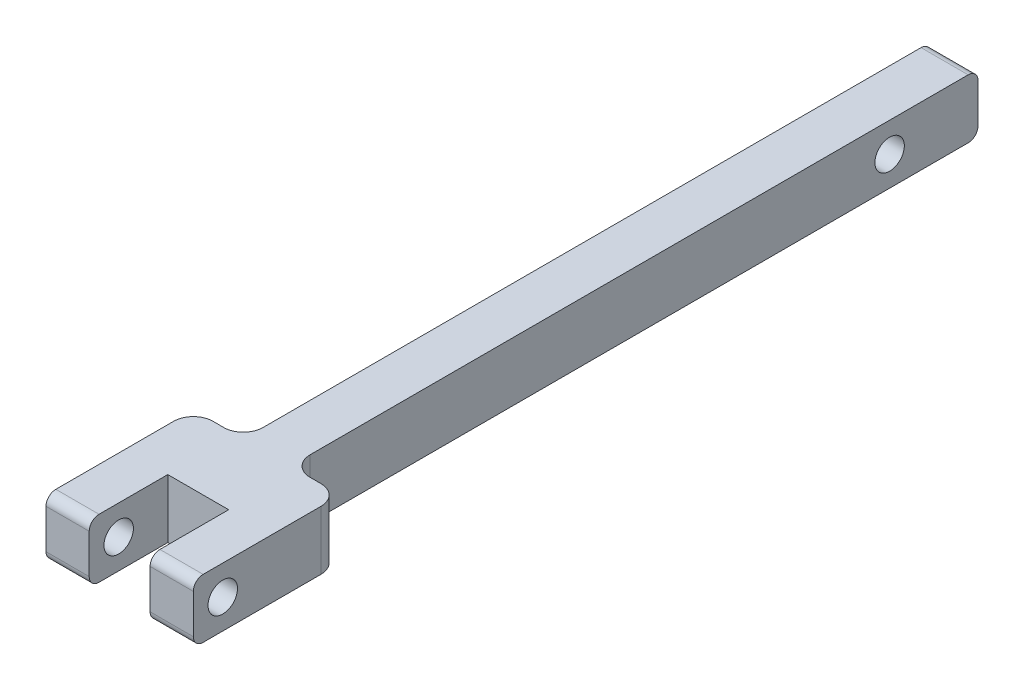
from build123d import *
from build123d.topology import SkipClean

# Parameters (mm, degrees)
SALIENTE_EXTRUIR1_DEPTH    = 2.4
CORTAR_EXTRUIR1_DEPTH      = 43.673293756
CORTAR_EXTRUIR1_DEPTH_BACK = 43.673293756
CROQUIS2_R                 = 1.5
CROQUIS3_R                 = 1.5
SALIENTE_EXTRUIR2_DEPTH    = 7.5
CORTAR_EXTRUIR2_DEPTH      = 3.1
REDONDEO1_R                = 2


with BuildPart() as part:
    # Croquis1 → Saliente-Extruir1 (new, symmetric)
    with BuildSketch(Plane(origin=(0, 0, 0), x_dir=(0, 0, -1), z_dir=(1, 0, 0))):
        with BuildLine():
            Line((-41.5, 3), (41.5, 3))
            ThreePointArc((41.5, 3), (42.207106781, 2.707106781), (42.5, 2))
            Line((42.5, 2), (42.5, -2))
            ThreePointArc((42.5, -2), (42.207106781, -2.707106781), (41.5, -3))
            Line((41.5, -3), (-41.5, -3))
            ThreePointArc((-41.5, -3), (-42.207106781, -2.707106781), (-42.5, -2))
            Line((-42.5, -2), (-42.5, 2))
            ThreePointArc((-42.5, 2), (-42.207106781, 2.707106781), (-41.5, 3))
        make_face()
    extrude(amount=SALIENTE_EXTRUIR1_DEPTH, both=True)

    # Croquis2 → Cortar-Extruir1 (cut, two sides: drawn at the far end of the back side and taken through both)
    with BuildSketch(Plane(origin=(0, 0, 0), x_dir=(0, 0, -1), z_dir=(1, 0, 0)).offset(-CORTAR_EXTRUIR1_DEPTH_BACK)):
        with Locations((-39.5, 0)):
            Circle(CROQUIS2_R)
        with Locations((33.5, 0)):
            Circle(CROQUIS2_R)
    extrude(amount=CORTAR_EXTRUIR1_DEPTH + CORTAR_EXTRUIR1_DEPTH_BACK, mode=Mode.SUBTRACT)

    # Croquis3 → Saliente-Extruir2 (add, symmetric)
    with SkipClean():  # the faces are left unmerged after this step: merging them gives an invalid solid
        with BuildSketch(Plane(origin=(0, 0, 0), x_dir=(0, 0, -1), z_dir=(1, 0, 0))):
            with BuildLine():
                Line((-42.5, 2), (-42.5, -2))
                ThreePointArc((-42.5, -2), (-42.207106781, -2.707106781), (-41.5, -3))
                Line((-41.5, -3), (-27.5, -3))
                Line((-27.5, -3), (-27.5, 3))
                Line((-27.5, 3), (-41.5, 3))
                ThreePointArc((-41.5, 3), (-42.207106781, 2.707106781), (-42.5, 2))
            make_face()
            with Locations((-39.5, 0)):
                Circle(CROQUIS3_R, mode=Mode.SUBTRACT)
        extrude(amount=SALIENTE_EXTRUIR2_DEPTH, both=True)
    add(part.part.scale(1), mode=Mode.REPLACE)  # the faces are merged on a copy

    # Croquis4 → Cortar-Extruir2 (cut, symmetric)
    with BuildSketch(Plane(origin=(0, 0, 0), x_dir=(0, 0, -1), z_dir=(1, 0, 0))):
        with BuildLine():
            Line((-41.5, 3), (-34.5, 3))
            Line((-34.5, 3), (-34.5, -3))
            Line((-34.5, -3), (-41.5, -3))
            ThreePointArc((-41.5, -3), (-42.207106781, -2.707106781), (-42.5, -2))
            Line((-42.5, -2), (-42.5, 2))
            ThreePointArc((-42.5, 2), (-42.207106781, 2.707106781), (-41.5, 3))
        make_face()
    extrude(amount=CORTAR_EXTRUIR2_DEPTH, both=True, mode=Mode.SUBTRACT)

    # Redondeo1
    redondeo1_edges = [part.edges().sort_by_distance(p)[0] for p in [
        (2.4, 0, 27.5),
        (-2.4, 0, 27.5),
        (7.5, 0, 27.5),
        (-7.5, 0, 27.5),
    ]]
    fillet(redondeo1_edges, radius=REDONDEO1_R)


solid = part.part
